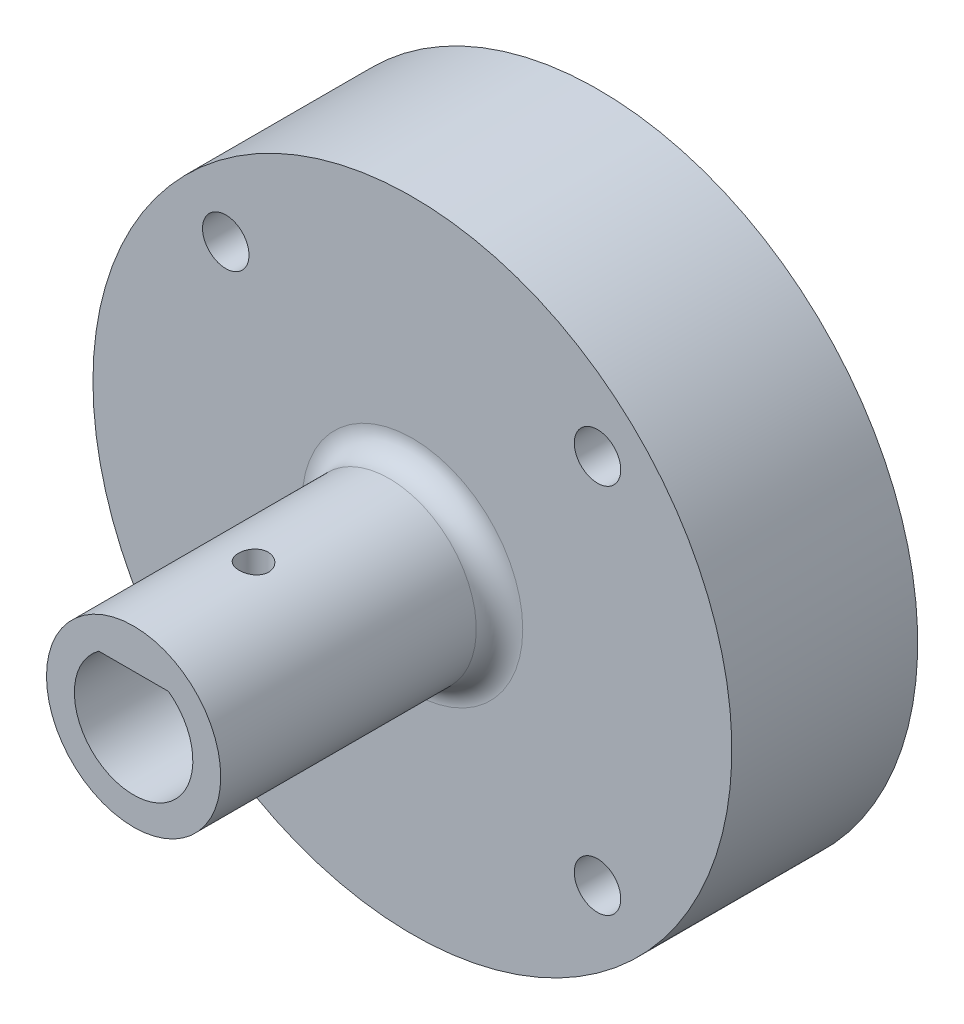
from build123d import *

# Parameters (mm, degrees)
SKETCH1_R           = 7.5
SKETCH1_R_2         = 5.1
BOSS_EXTRUDE1_DEPTH = 24
BOSS_EXTRUDE2_START = -20
BOSS_EXTRUDE2_DEPTH = 20
SKETCH3_R           = 1.3
CUT_EXTRUDE1_DEPTH  = 24
SKETCH4_R           = 27.5
BOSS_EXTRUDE3_DEPTH = 16
FILLET1_R           = 2
CUT_EXTRUDE2_DEPTH  = 20


with BuildPart() as part:
    # Sketch1 → Boss-Extrude1 (new body)
    with BuildSketch(Plane.XY):
        Circle(SKETCH1_R)
        Circle(SKETCH1_R_2, mode=Mode.SUBTRACT)
    extrude(amount=BOSS_EXTRUDE1_DEPTH)

    # Sketch2 → Boss-Extrude2 (add)
    with BuildSketch(Plane.XY.offset(24).offset(BOSS_EXTRUDE2_START)):
        with BuildLine():
            ThreePointArc((3, 4.124318125), (0, 5.1), (-3, 4.124318125))
            Line((-3, 4.124318125), (3, 4.124318125))
        make_face()
    extrude(amount=BOSS_EXTRUDE2_DEPTH)

    # Sketch3 → Cut-Extrude1 (cut)
    with BuildSketch(Plane.XZ.offset(-4.124318125)):
        with Locations((0.322177093, 14)):
            Circle(SKETCH3_R)
    extrude(amount=-CUT_EXTRUDE1_DEPTH, mode=Mode.SUBTRACT)

    # Sketch4 → Boss-Extrude3 (add)
    with BuildSketch(Plane(origin=(0, 0, 0), x_dir=(-1, 0, 0), z_dir=(0, 0, -1))):
        Circle(SKETCH4_R)
    extrude(amount=BOSS_EXTRUDE3_DEPTH)

    # Fillet1
    fillet1_edges = [part.edges().sort_by_distance(p)[0] for p in [
        (-7.5, 0, 0),
    ]]
    fillet(fillet1_edges, radius=FILLET1_R)

    # Sketch5 → Cut-Extrude2 (cut)
    with BuildSketch(Plane(origin=(0, 0, -16), x_dir=(-1, 0, 0), z_dir=(0, 0, -1))):
        with BuildLine():
            ThreePointArc((-17.935311267, -15.886794718), (-15.935311267, -17.886794718), (-13.935311267, -15.886794718))
            ThreePointArc((-13.935311267, -15.886794718), (-15.935311267, -13.886794718), (-17.935311267, -15.886794718))
        make_face()
        with BuildLine():
            ThreePointArc((14.064688733, -15.886794718), (16.064688733, -17.886794718), (18.064688733, -15.886794718))
            ThreePointArc((18.064688733, -15.886794718), (16.064688733, -13.886794718), (14.064688733, -15.886794718))
        make_face()
        with BuildLine():
            ThreePointArc((18.064688733, 16.113205282), (16.064688733, 18.113205282), (14.064688733, 16.113205282))
            ThreePointArc((14.064688733, 16.113205282), (16.064688733, 14.113205282), (18.064688733, 16.113205282))
        make_face()
        with BuildLine():
            ThreePointArc((-13.935311267, 16.113205282), (-15.935311267, 18.113205282), (-17.935311267, 16.113205282))
            ThreePointArc((-17.935311267, 16.113205282), (-15.935311267, 14.113205282), (-13.935311267, 16.113205282))
        make_face()
    extrude(amount=-CUT_EXTRUDE2_DEPTH, mode=Mode.SUBTRACT)


solid = part.part
